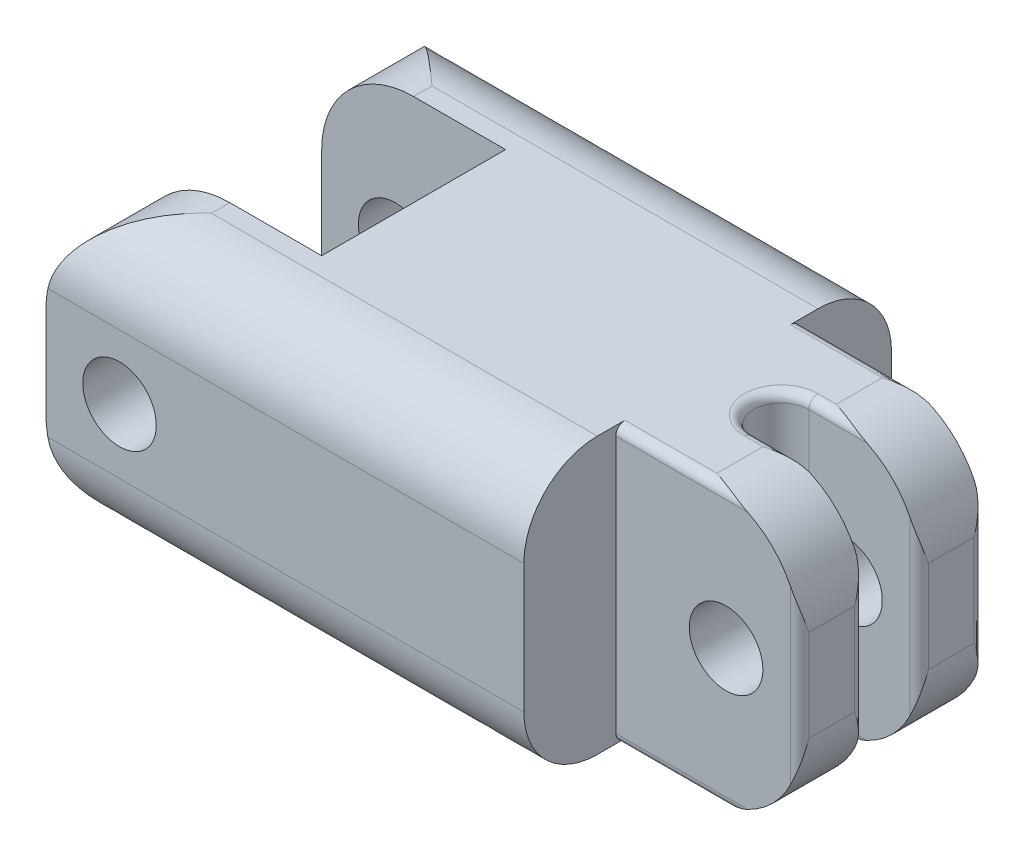
from build123d import *

# Parameters (mm, degrees)
BOSS_EXTRUDE1_DEPTH      = 23
BOSS_EXTRUDE1_DEPTH_BACK = 13
SKETCH1_W                = 20
SKETCH1_H                = 15
SKETCH2_W                = 10
SKETCH2_H                = 10
CUT_EXTRUDE1_DEPTH       = 19
VARFILLET1_R             = 4
VARFILLET2_R             = 4
CUT_EXTRUDE3_DEPTH       = 11
CUT_EXTRUDE3_DEPTH_BACK  = 11
SKETCH4_R                = 2
SKETCH5_W                = 10
SKETCH5_H                = 5
CUT_EXTRUDE4_DEPTH       = 19
FILLET1_R                = 0.5
CUT_EXTRUDE5_DEPTH       = 19
CUT_EXTRUDE5_DEPTH_BACK  = 19
SKETCH6_R                = 2
CUT_EXTRUDE6_DEPTH       = 19
CUT_EXTRUDE6_DEPTH_BACK  = 19


with BuildPart() as part:
    # Sketch1 → Boss-Extrude1 (new, two sides: drawn at the far end of the back side and taken through both)
    with BuildSketch(Plane(origin=(0, 0, 0), x_dir=(0, 0, -1), z_dir=(1, 0, 0)).offset(-BOSS_EXTRUDE1_DEPTH_BACK)):
        Rectangle(SKETCH1_W, SKETCH1_H)
    extrude(amount=BOSS_EXTRUDE1_DEPTH + BOSS_EXTRUDE1_DEPTH_BACK)

    # Sketch2 → Cut-Extrude1 (cut)
    with BuildSketch(Plane(origin=(0, 7.5, 0), x_dir=(1, 0, 0), z_dir=(0, 1, 0))):
        with Locations((-8, 0)):
            Rectangle(SKETCH2_W, SKETCH2_H)
    extrude(amount=-CUT_EXTRUDE1_DEPTH, mode=Mode.SUBTRACT)

    # VarFillet1
    varfillet1_edges = [part.edges().sort_by_distance(p)[0] for p in [
        (5, 7.5, -10),
        (5, 7.5, 10),
    ]]
    fillet(varfillet1_edges, radius=VARFILLET1_R)

    # VarFillet2
    varfillet2_edges = [part.edges().sort_by_distance(p)[0] for p in [
        (5, -7.5, 10),
        (5, -7.5, -10),
    ]]
    fillet(varfillet2_edges, radius=VARFILLET2_R)

    # Sketch4 → Cut-Extrude3 (cut, two sides: drawn at the far end of the back side and taken through both)
    with BuildSketch(Plane.XY.offset(-CUT_EXTRUDE3_DEPTH_BACK)):
        with Locations((-9, 0)):
            Circle(SKETCH4_R)
    extrude(amount=CUT_EXTRUDE3_DEPTH + CUT_EXTRUDE3_DEPTH_BACK, mode=Mode.SUBTRACT)

    # Sketch5 → Cut-Extrude4 (cut)
    with BuildSketch(Plane(origin=(0, 7.5, 0), x_dir=(1, 0, 0), z_dir=(0, 1, 0))):
        with Locations((18, 7.5)):
            Rectangle(SKETCH5_W, SKETCH5_H)
        with BuildLine():
            Line((23, 1.5), (17, 1.5))
            ThreePointArc((17, 1.5), (15.5, 0), (17, -1.5))
            Line((17, -1.5), (23, -1.5))
            Line((23, -1.5), (23, 1.5))
        make_face()
        with Locations((18, -7.5)):
            Rectangle(SKETCH5_W, SKETCH5_H)
    extrude(amount=-CUT_EXTRUDE4_DEPTH, mode=Mode.SUBTRACT)

    # Fillet1
    fillet1_edges = [part.edges().sort_by_distance(p)[0] for p in [
        (20, 7.5, -1.5),
        (20, 7.5, 1.5),
        (20, -7.5, 1.5),
        (20, -7.5, -1.5),
        (23, 0, 5),
        (23, 7.5, 3.25),
        (23, 0, 1.5),
        (23, -7.5, 3.25),
        (15.5, 7.5, 0),
        (15.5, -7.5, 0),
        (23, 0, -1.5),
        (23, 7.5, -3.25),
        (23, 0, -5),
        (23, -7.5, -3.25),
        (18, -7.5, -5),
        (18, -7.5, 5),
        (18, 7.5, -5),
        (18, 7.5, 5),
    ]]
    fillet(fillet1_edges, radius=FILLET1_R)

    # Sketch6 → Cut-Extrude5 (cut, two sides: drawn at the far end of the back side and taken through both)
    with BuildSketch(Plane.XY.offset(-CUT_EXTRUDE5_DEPTH_BACK)):
        with Locations((19, 0)):
            Circle(SKETCH6_R)
    extrude(amount=CUT_EXTRUDE5_DEPTH + CUT_EXTRUDE5_DEPTH_BACK, mode=Mode.SUBTRACT)

    # Sketch7 → Cut-Extrude6 (cut, two sides: drawn at the far end of the back side and taken through both)
    with BuildSketch(Plane.XY.offset(-CUT_EXTRUDE6_DEPTH_BACK)):
        with BuildLine():
            Line((-8, 7.5), (-13, 7.5))
            Line((-13, 7.5), (-13, 2.5))
            ThreePointArc((-13, 2.5), (-11.535533906, 6.035533906), (-8, 7.5))
        make_face()
        with BuildLine():
            Line((-13, -7.5), (-13, -2.5))
            ThreePointArc((-13, -2.5), (-11.535533906, -6.035533906), (-8, -7.5))
            Line((-8, -7.5), (-13, -7.5))
        make_face()
        with BuildLine():
            Line((18, 7.5), (23, 7.5))
            Line((23, 7.5), (23, 2.5))
            ThreePointArc((23, 2.5), (21.535533906, 6.035533906), (18, 7.5))
        make_face()
        with BuildLine():
            Line((23, -7.5), (23, -2.5))
            ThreePointArc((23, -2.5), (21.535533906, -6.035533906), (18, -7.5))
            Line((18, -7.5), (23, -7.5))
        make_face()
    extrude(amount=CUT_EXTRUDE6_DEPTH + CUT_EXTRUDE6_DEPTH_BACK, mode=Mode.SUBTRACT)


solid = part.part
